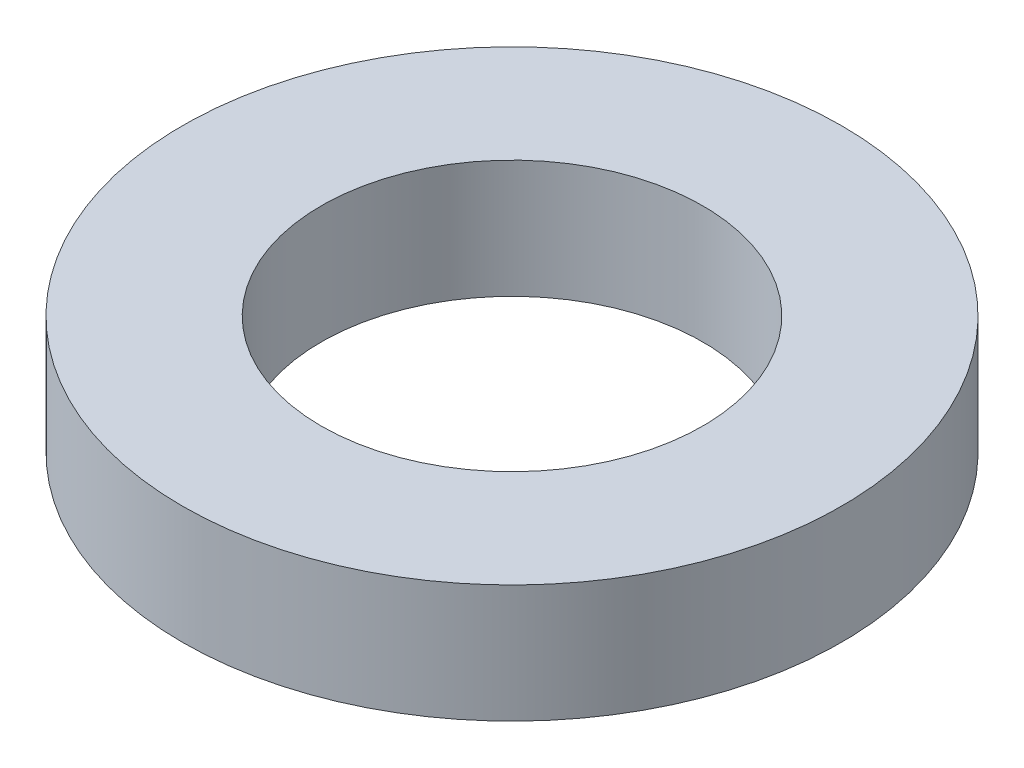
from build123d import *

# Parameters (mm, degrees)
SKETCH1_R           = 47.5
BOSS_EXTRUDE1_DEPTH = 17
SKETCH2_R           = 27.5
CUT_EXTRUDE1_DEPTH  = 70.292856775


with BuildPart() as part:
    # Sketch1 → Boss-Extrude1 (new body)
    with BuildSketch(Plane(origin=(0, 0, 0), x_dir=(1, 0, 0), z_dir=(0, 1, 0))):
        Circle(SKETCH1_R)
    extrude(amount=BOSS_EXTRUDE1_DEPTH)

    # Sketch2 → Cut-Extrude1 (cut, through all)
    with BuildSketch(Plane(origin=(0, 0, 0), x_dir=(1, 0, 0), z_dir=(0, 1, 0))):
        Circle(SKETCH2_R)
    extrude(amount=CUT_EXTRUDE1_DEPTH, mode=Mode.SUBTRACT)


solid = part.part
